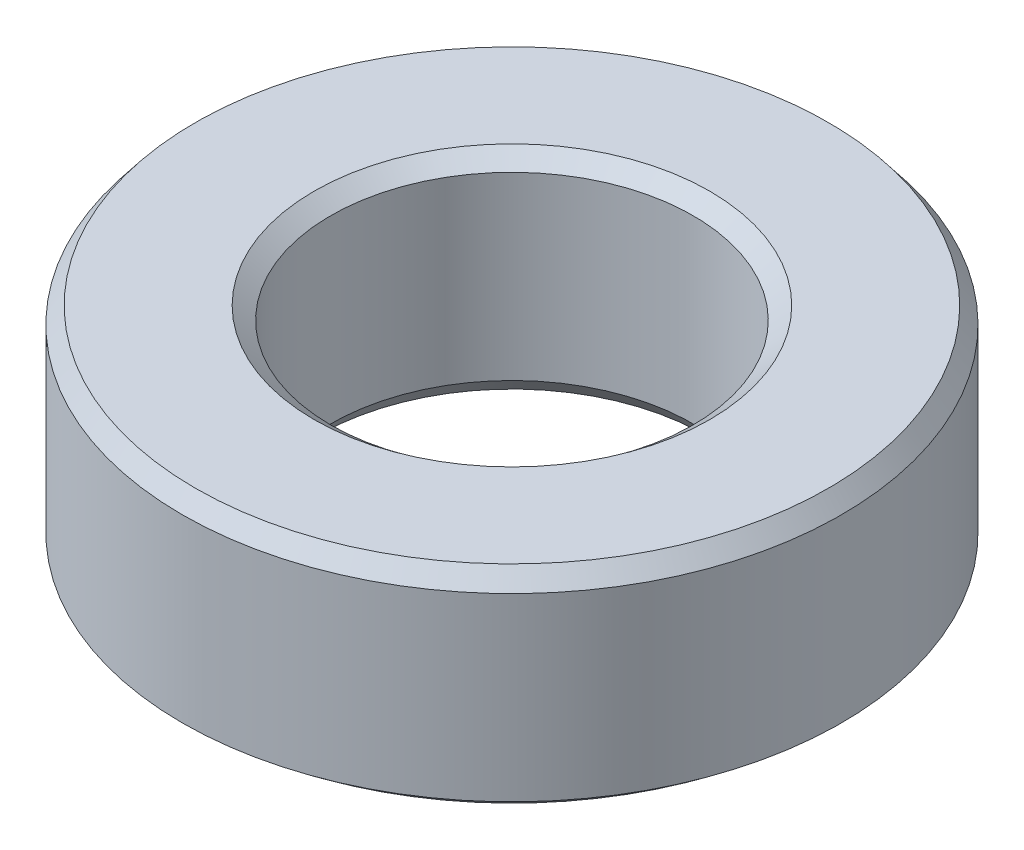
from build123d import *
from OCP.BRepFilletAPI import BRepFilletAPI_MakeChamfer

# Parameters (mm, degrees)
SKETCH1_R           = 50
BOSS_EXTRUDE1_DEPTH = 31.829342262
SKETCH2_R           = 27.501706847
CUT_EXTRUDE1_DEPTH  = 78.544226277
CHAMFER1_SIZE       = 2.516458853
CHAMFER1_SIZE2      = 1.960242754


with BuildPart() as part:
    # Sketch1 → Boss-Extrude1 (new body)
    with BuildSketch(Plane(origin=(0, 0, 0), x_dir=(1, 0, 0), z_dir=(0, 1, 0))):
        Circle(SKETCH1_R)
    extrude(amount=BOSS_EXTRUDE1_DEPTH)

    # Sketch2 → Cut-Extrude1 (cut, through all)
    with BuildSketch(Plane(origin=(0, 0, 0), x_dir=(1, 0, 0), z_dir=(0, 1, 0))):
        Circle(SKETCH2_R)
    extrude(amount=CUT_EXTRUDE1_DEPTH, mode=Mode.SUBTRACT)

    # Chamfer1: one chamfer whose edges measure the first distance from different faces: ONE call of the kernel's chamfer builder (chamfer() names one face for all edges)
    chamfer1_edges_1 = [part.edges().sort_by_distance(p)[0] for p in [
        (-27.501706847, 31.829342262, 0),
    ]]
    chamfer1_side_1 = [part.faces().sort_by_distance(p)[0] for p in [
        (-48.585786438, 31.829342262, 0),
    ]]
    chamfer1_edges_2 = [part.edges().sort_by_distance(p)[0] for p in [
        (-27.501706847, 0, 0),
    ]]
    chamfer1_side_2 = [part.faces().sort_by_distance(p)[0] for p in [
        (-27.501706847, 15.914671131, 0),
    ]]
    chamfer1_edges_3 = [part.edges().sort_by_distance(p)[0] for p in [
        (-50, 0, 0),
    ]]
    chamfer1_side_3 = [part.faces().sort_by_distance(p)[0] for p in [
        (-48.585786438, 0, 0),
    ]]
    chamfer1_edges_4 = [part.edges().sort_by_distance(p)[0] for p in [
        (-50, 31.829342262, 0),
    ]]
    chamfer1_side_4 = [part.faces().sort_by_distance(p)[0] for p in [
        (-50, 15.914671131, 0),
    ]]
    chamfer1 = BRepFilletAPI_MakeChamfer(part.part.solid().wrapped)
    for e in chamfer1_edges_1:
        chamfer1.Add(CHAMFER1_SIZE, CHAMFER1_SIZE2, e.wrapped, chamfer1_side_1[0].wrapped)  # the first distance lies on this face
    for e in chamfer1_edges_2:
        chamfer1.Add(CHAMFER1_SIZE, CHAMFER1_SIZE2, e.wrapped, chamfer1_side_2[0].wrapped)  # the first distance lies on this face
    for e in chamfer1_edges_3:
        chamfer1.Add(CHAMFER1_SIZE, CHAMFER1_SIZE2, e.wrapped, chamfer1_side_3[0].wrapped)  # the first distance lies on this face
    for e in chamfer1_edges_4:
        chamfer1.Add(CHAMFER1_SIZE, CHAMFER1_SIZE2, e.wrapped, chamfer1_side_4[0].wrapped)  # the first distance lies on this face
    add(Compound.cast(chamfer1.Shape()), mode=Mode.REPLACE)


solid = part.part
